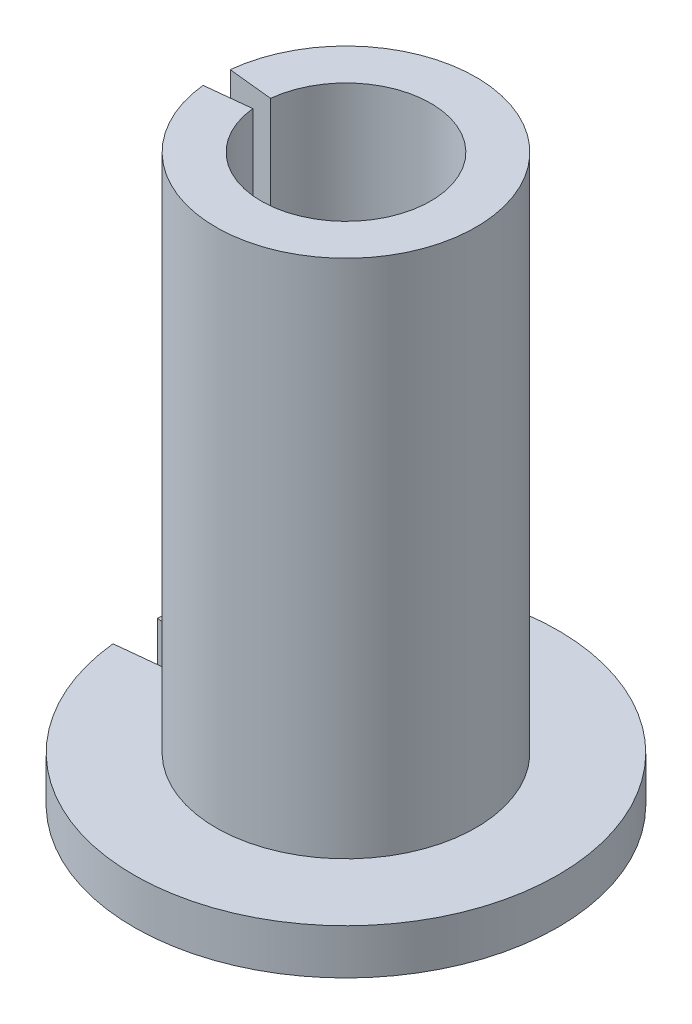
from build123d import *
from build123d.topology import SkipClean

# Parameters (mm, degrees)
REVOLVE1_ANGLE = 348


with BuildPart() as part:
    # Sketch1 → Revolve1 (revolve, symmetric)
    with SkipClean():  # the faces are left unmerged after this step: merging them gives an invalid solid
        with BuildSketch(Plane.XY) as revolve1_sk:
            Polygon((3, 20), (3, 0), (7.5, 0), (7.5, 1.6), (4.6, 1.6), (4.6, 20), align=None)
        revolve(axis=Axis((0, 0, 0), (0, 1, 0)), revolution_arc=REVOLVE1_ANGLE / 2)
        revolve(revolve1_sk.sketch, axis=Axis((0, 0, 0), (0, -1, 0)), revolution_arc=REVOLVE1_ANGLE / 2)
    add(part.part.scale(1), mode=Mode.REPLACE)  # the faces are merged on a copy


solid = part.part
